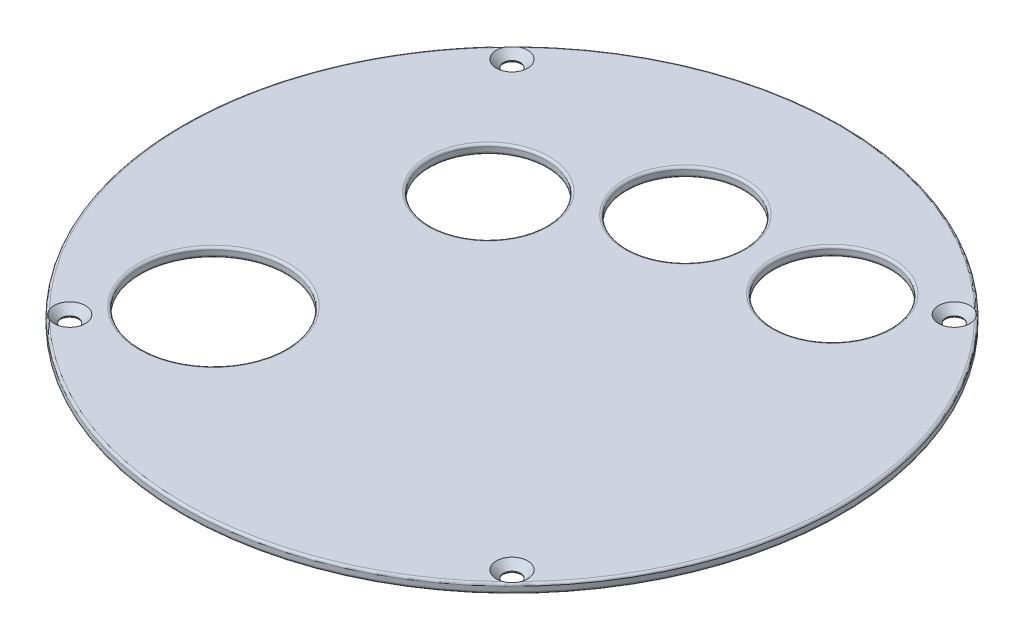
from build123d import *

# Parameters (mm, degrees)
SKETCH1_R           = 69.55
SKETCH1_R_2         = 1.8
SKETCH1_R_3         = 15.3
SKETCH1_R_4         = 12.3
BOSS_EXTRUDE1_DEPTH = 2
CHAMFER3_SIZE       = 1.5
FILLET1_R           = 0.5


with BuildPart() as part:
    # Sketch1 → Boss-Extrude1 (new body)
    with BuildSketch(Plane(origin=(0, 0, 0), x_dir=(1, 0, 0), z_dir=(0, 1, 0))):
        with Locations(Location((0, 0, 0), (0, 0, 270))):
            Circle(SKETCH1_R)
        with Locations(Location((-46.669047558, -46.669047558, 0), (0, 0, 270))):
            Circle(SKETCH1_R_2, mode=Mode.SUBTRACT)
        with Locations(Location((-33, -30, 0), (0, 0, 270))):
            Circle(SKETCH1_R_3, mode=Mode.SUBTRACT)
        with Locations(Location((46.669047558, -46.669047558, 0), (0, 0, 270))):
            Circle(SKETCH1_R_2, mode=Mode.SUBTRACT)
        with Locations(Location((-25, 20, 0), (0, 0, 270))):
            Circle(SKETCH1_R_4, mode=Mode.SUBTRACT)
        with Locations(Location((-46.669047558, 46.669047558, 0), (0, 0, 270))):
            Circle(SKETCH1_R_2, mode=Mode.SUBTRACT)
        with Locations(Location((0, 36.583123952, 0), (0, 0, 270))):
            Circle(SKETCH1_R_4, mode=Mode.SUBTRACT)
        with Locations(Location((30, 37.583123952, 0), (0, 0, 270))):
            Circle(SKETCH1_R_4, mode=Mode.SUBTRACT)
        with Locations(Location((46.669047558, 46.669047558, 0), (0, 0, 270))):
            Circle(SKETCH1_R_2, mode=Mode.SUBTRACT)
    extrude(amount=BOSS_EXTRUDE1_DEPTH)

    # Chamfer3
    chamfer3_edges = [part.edges().sort_by_distance(p)[0] for p in [
        (-46.669047558, 2, 44.869047558),
        (46.669047558, 2, 44.869047558),
        (46.669047558, 2, -48.469047558),
        (-46.669047558, 2, -48.469047558),
    ]]
    chamfer(chamfer3_edges, length=CHAMFER3_SIZE)

    # Fillet1
    # the kernel refuses this fillet: 0.5 mm, written as the material it takes off along each edge
    with BuildSketch(Plane(origin=(0, 0, 0), x_dir=(0, 0, 1), z_dir=(-1, 0, 0))) as fillet1_piece_1:
        with BuildLine():
            CenterArc((69.55 - FILLET1_R, FILLET1_R), FILLET1_R, 270, 90)
            Line((69.55, FILLET1_R), (69.55, 0))
            Line((69.55, 0), (69.55 - FILLET1_R, 0))
        make_face()
    revolve(axis=Axis((0, 0, 0), (0, 1, 0)), mode=Mode.SUBTRACT)
    with BuildSketch(Plane(origin=(-46.669047558, 0, -46.669047558), x_dir=(0, 0, 1), z_dir=(-1, 0, 0))) as fillet1_piece_2:
        with BuildLine():
            CenterArc((1.8 + FILLET1_R, FILLET1_R), FILLET1_R, 180, 90)
            Line((1.8, FILLET1_R), (1.8, 0))
            Line((1.8, 0), (1.8 + FILLET1_R, 0))
        make_face()
    revolve(axis=Axis((-46.669047558, 0, -46.669047558), (0, 1, 0)), mode=Mode.SUBTRACT)
    with BuildSketch(Plane(origin=(46.669047558, 0, -46.669047558), x_dir=(0, 0, 1), z_dir=(-1, 0, 0))) as fillet1_piece_3:
        with BuildLine():
            CenterArc((1.8 + FILLET1_R, FILLET1_R), FILLET1_R, 180, 90)
            Line((1.8, FILLET1_R), (1.8, 0))
            Line((1.8, 0), (1.8 + FILLET1_R, 0))
        make_face()
    revolve(axis=Axis((46.669047558, 0, -46.669047558), (0, 1, 0)), mode=Mode.SUBTRACT)
    with BuildSketch(Plane(origin=(46.669047558, 0, 46.669047558), x_dir=(0, 0, 1), z_dir=(-1, 0, 0))) as fillet1_piece_4:
        with BuildLine():
            CenterArc((1.8 + FILLET1_R, FILLET1_R), FILLET1_R, 180, 90)
            Line((1.8, FILLET1_R), (1.8, 0))
            Line((1.8, 0), (1.8 + FILLET1_R, 0))
        make_face()
    revolve(axis=Axis((46.669047558, 0, 46.669047558), (0, 1, 0)), mode=Mode.SUBTRACT)
    with BuildSketch(Plane(origin=(-33, 2, 30), x_dir=(0, 0, 1), z_dir=(-1, 0, 0))) as fillet1_piece_5:
        with BuildLine():
            CenterArc((15.3 + FILLET1_R, -FILLET1_R), FILLET1_R, 90, 90)
            Line((15.3, -FILLET1_R), (15.3, 0))
            Line((15.3, 0), (15.3 + FILLET1_R, 0))
        make_face()
    revolve(axis=Axis((-33, 2, 30), (0, 1, 0)), mode=Mode.SUBTRACT)
    with BuildSketch(Plane(origin=(-46.669047558, 0, 46.669047558), x_dir=(0, 0, 1), z_dir=(-1, 0, 0))) as fillet1_piece_6:
        with BuildLine():
            CenterArc((1.8 + FILLET1_R, FILLET1_R), FILLET1_R, 180, 90)
            Line((1.8 + FILLET1_R, 0), (1.8, 0))
            Line((1.8, 0), (1.8, FILLET1_R))
        make_face()
    revolve(axis=Axis((-46.669047558, 0, 46.669047558), (0, 1, 0)), mode=Mode.SUBTRACT)
    with BuildSketch(Plane(origin=(-25, 0, -20), x_dir=(0, 0, 1), z_dir=(-1, 0, 0))) as fillet1_piece_7:
        with BuildLine():
            CenterArc((12.3 + FILLET1_R, FILLET1_R), FILLET1_R, 180, 90)
            Line((12.3, FILLET1_R), (12.3, 0))
            Line((12.3, 0), (12.3 + FILLET1_R, 0))
        make_face()
    revolve(axis=Axis((-25, 0, -20), (0, 1, 0)), mode=Mode.SUBTRACT)
    with BuildSketch(Plane(origin=(0, 0, -36.583123952), x_dir=(0, 0, 1), z_dir=(-1, 0, 0))) as fillet1_piece_8:
        with BuildLine():
            CenterArc((12.3 + FILLET1_R, FILLET1_R), FILLET1_R, 180, 90)
            Line((12.3, FILLET1_R), (12.3, 0))
            Line((12.3, 0), (12.3 + FILLET1_R, 0))
        make_face()
    revolve(axis=Axis((0, 0, -36.583123952), (0, 1, 0)), mode=Mode.SUBTRACT)
    with BuildSketch(Plane(origin=(30, 0, -37.583123952), x_dir=(0, 0, 1), z_dir=(-1, 0, 0))) as fillet1_piece_9:
        with BuildLine():
            CenterArc((12.3 + FILLET1_R, FILLET1_R), FILLET1_R, 180, 90)
            Line((12.3, FILLET1_R), (12.3, 0))
            Line((12.3, 0), (12.3 + FILLET1_R, 0))
        make_face()
    revolve(axis=Axis((30, 0, -37.583123952), (0, 1, 0)), mode=Mode.SUBTRACT)
    with BuildSketch(Plane(origin=(-33, 0, 30), x_dir=(0, 0, 1), z_dir=(-1, 0, 0))) as fillet1_piece_10:
        with BuildLine():
            CenterArc((15.3 + FILLET1_R, FILLET1_R), FILLET1_R, 180, 90)
            Line((15.3, FILLET1_R), (15.3, 0))
            Line((15.3, 0), (15.3 + FILLET1_R, 0))
        make_face()
    revolve(axis=Axis((-33, 0, 30), (0, 1, 0)), mode=Mode.SUBTRACT)
    with BuildSketch(Plane(origin=(30, 2, -37.583123952), x_dir=(0, 0, 1), z_dir=(-1, 0, 0))) as fillet1_piece_11:
        with BuildLine():
            CenterArc((12.3 + FILLET1_R, -FILLET1_R), FILLET1_R, 90, 90)
            Line((12.3, -FILLET1_R), (12.3, 0))
            Line((12.3, 0), (12.3 + FILLET1_R, 0))
        make_face()
    revolve(axis=Axis((30, 2, -37.583123952), (0, 1, 0)), mode=Mode.SUBTRACT)
    with BuildSketch(Plane(origin=(0, 2, -36.583123952), x_dir=(0, 0, 1), z_dir=(-1, 0, 0))) as fillet1_piece_12:
        with BuildLine():
            CenterArc((12.3 + FILLET1_R, -FILLET1_R), FILLET1_R, 90, 90)
            Line((12.3, -FILLET1_R), (12.3, 0))
            Line((12.3, 0), (12.3 + FILLET1_R, 0))
        make_face()
    revolve(axis=Axis((0, 2, -36.583123952), (0, 1, 0)), mode=Mode.SUBTRACT)
    with BuildSketch(Plane(origin=(-25, 2, -20), x_dir=(0, 0, 1), z_dir=(-1, 0, 0))) as fillet1_piece_13:
        with BuildLine():
            CenterArc((12.3 + FILLET1_R, -FILLET1_R), FILLET1_R, 90, 90)
            Line((12.3, -FILLET1_R), (12.3, 0))
            Line((12.3, 0), (12.3 + FILLET1_R, 0))
        make_face()
    revolve(axis=Axis((-25, 2, -20), (0, 1, 0)), mode=Mode.SUBTRACT)
    with BuildSketch(Plane(origin=(0, 2, 0), x_dir=(0, 0, 1), z_dir=(-1, 0, 0))) as fillet1_piece_14:
        with BuildLine():
            CenterArc((69.55 - FILLET1_R, -FILLET1_R), FILLET1_R, 0, 90)
            Line((69.55, -FILLET1_R), (69.55, 0))
            Line((69.55, 0), (69.55 - FILLET1_R, 0))
        make_face()
    revolve(axis=Axis((0, 2, 0), (0, 1, 0)), mode=Mode.SUBTRACT)


solid = part.part
